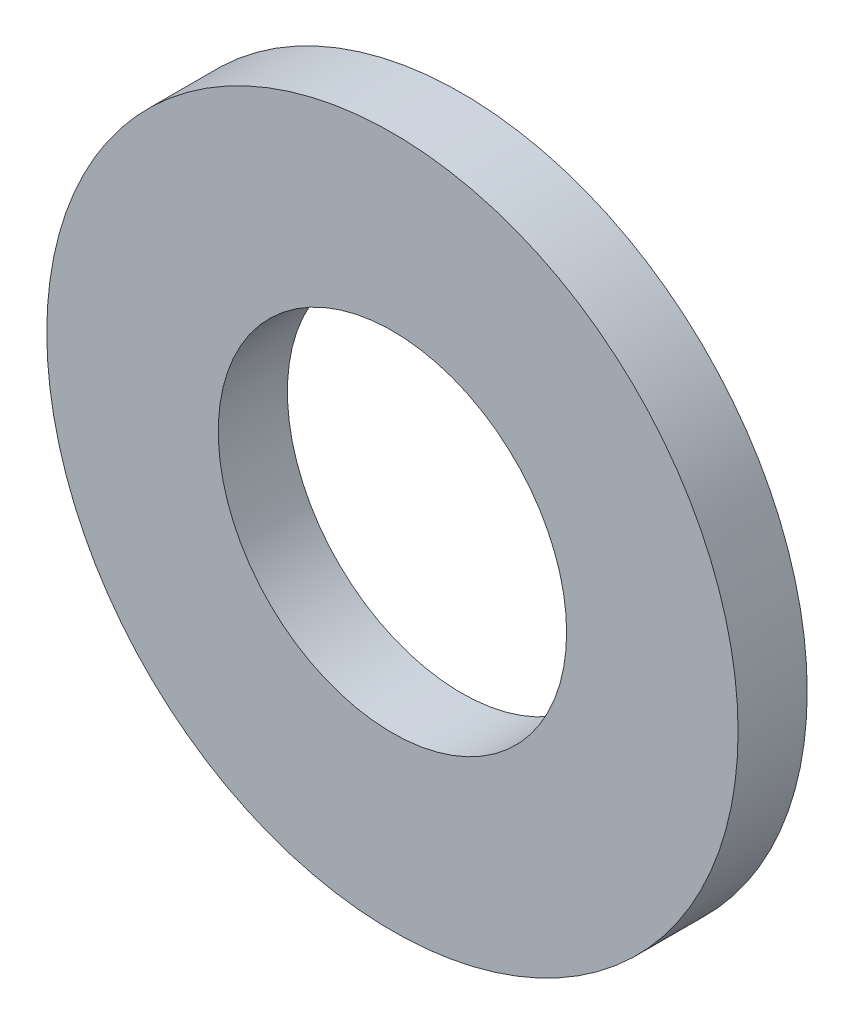
from build123d import *

# Parameters (mm, degrees)
SKETCH1_R           = 7.9375
SKETCH1_R_2         = 4
BOSS_EXTRUDE1_DEPTH = 1.5875


with BuildPart() as part:
    # Sketch1 → Boss-Extrude1 (new body)
    with BuildSketch(Plane.XY):
        Circle(SKETCH1_R)
        Circle(SKETCH1_R_2, mode=Mode.SUBTRACT)
    extrude(amount=BOSS_EXTRUDE1_DEPTH)


solid = part.part
